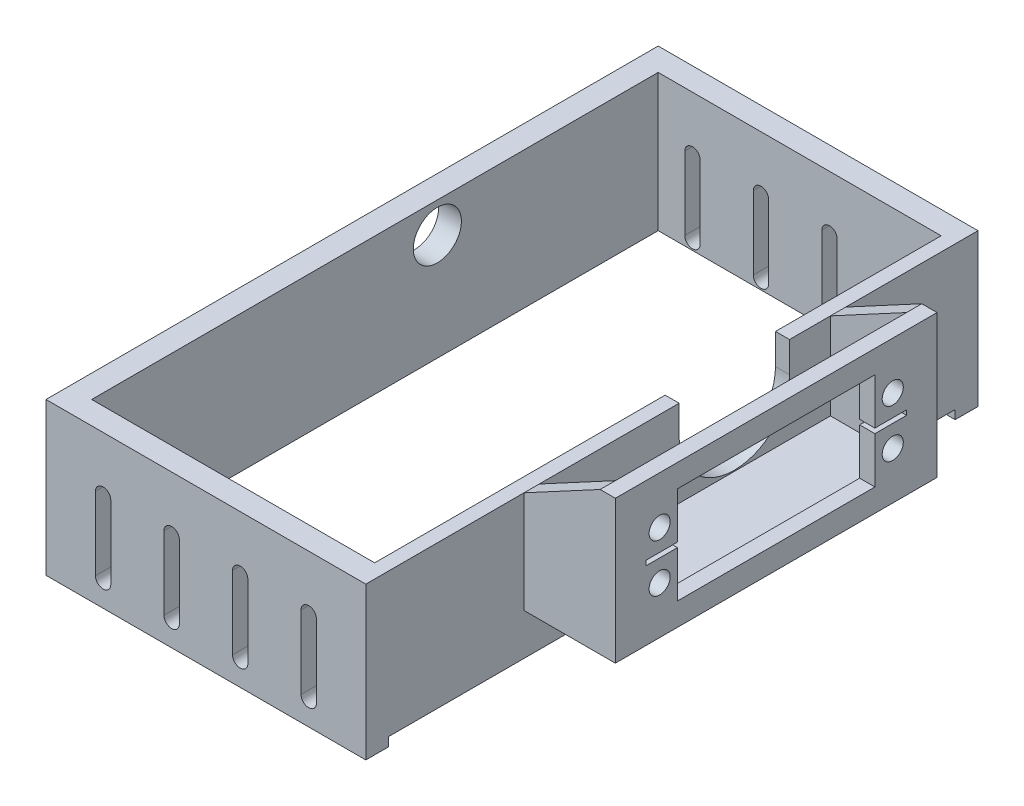
from build123d import *

# Parameters (mm, degrees)
SKETCH4_W                = 66.675
SKETCH4_H                = 127.62500002
SKETCH4_W_2              = 57.15
SKETCH4_H_2              = 118.10000002
BOSS_EXTRUDE1_DEPTH      = 19.05
BOSS_EXTRUDE2_START      = 19.05
SKETCH5_W                = 66.675
SKETCH5_H                = 127.62500002
BOSS_EXTRUDE2_DEPTH      = 12.7
FILLET1_SIZE             = 3.175
SKETCH14_W               = 57.15
SKETCH14_H               = 118.10000002
CUT_EXTRUDE8_DEPTH       = 12.7
SKETCH26_W               = 1.8415
SKETCH26_H               = 118.10000002
CUT_EXTRUDE11_DEPTH      = 79.685999795
CUT_EXTRUDE12_REACH      = 99.599
SKETCH27_W               = 118.10000002
SKETCH27_H               = 1.8415
SKETCH30_R               = 5.0165
CUT_EXTRUDE13_DEPTH      = 98.59945329
CUT_EXTRUDE16_DEPTH      = 2.921
BOSS_EXTRUDE4_DEPTH      = 19.05
SKETCH34_W               = 67.061999988
SKETCH34_H               = 29.778999878
BOSS_EXTRUDE5_DEPTH      = 3.175
CUT_EXTRUDE17_START      = 19.05
SKETCH32_R               = 2.200000045
CUT_EXTRUDE17_DEPTH      = 3.175
BOSS_EXTRUDE6_DEPTH      = 3.175
BOSS_EXTRUDE8_START      = -63.887
BOSS_EXTRUDE8_DEPTH      = 3.175
CUT_EXTRUDE18_DEPTH      = 144.721378339
CUT_EXTRUDE18_DEPTH_BACK = 144.721378339


with BuildPart() as part:
    # Sketch4 → Boss-Extrude1 (new body)
    with BuildSketch(Plane(origin=(0, 0, 0), x_dir=(1, 0, 0), z_dir=(0, 1, 0))):
        Rectangle(SKETCH4_W, SKETCH4_H)
        Rectangle(SKETCH4_W_2, SKETCH4_H_2, mode=Mode.SUBTRACT)
    extrude(amount=BOSS_EXTRUDE1_DEPTH)

    # Sketch5 → Boss-Extrude2 (add)
    with BuildSketch(Plane(origin=(0, 0, 0), x_dir=(1, 0, 0), z_dir=(0, 1, 0)).offset(BOSS_EXTRUDE2_START)):
        Rectangle(SKETCH5_W, SKETCH5_H)
    extrude(amount=BOSS_EXTRUDE2_DEPTH)

    # Fillet1
    fillet1_edges = [part.edges().sort_by_distance(p)[0] for p in [
        (-28.575, 0, 0),
        (0, 0, 59.05000001),
        (28.575, 0, 0),
        (0, 0, -59.05000001),
    ]]
    chamfer(fillet1_edges, length=FILLET1_SIZE)

    # Sketch14 → Cut-Extrude8 (cut)
    with BuildSketch(Plane.XZ.offset(-19.05)):
        Rectangle(SKETCH14_W, SKETCH14_H)
    extrude(amount=-CUT_EXTRUDE8_DEPTH, mode=Mode.SUBTRACT)

    # Sketch26 → Cut-Extrude11 (cut, through all)
    with BuildSketch(Plane(origin=(0, 31.75, 0), x_dir=(1, 0, 0), z_dir=(0, 1, 0))):
        with Locations((29.49575, 0)):
            Rectangle(SKETCH26_W, SKETCH26_H)
    extrude(amount=-CUT_EXTRUDE11_DEPTH, mode=Mode.SUBTRACT)

    # Sketch27 → Cut-Extrude12 (cut, up to next)
    with BuildSketch(Plane(origin=(33.3375, 0, 0), x_dir=(0, 0, -1), z_dir=(1, 0, 0)), mode=Mode.PRIVATE) as cut_extrude12_sk1:
        with Locations((0, 0.92075)):
            Rectangle(SKETCH27_W, SKETCH27_H)
    cut_extrude12_tool1 = extrude(cut_extrude12_sk1.sketch, amount=-CUT_EXTRUDE12_REACH, mode=Mode.PRIVATE) & part.part
    add(cut_extrude12_tool1.solids().sort_by_distance((33.3375, 0.92075, 0))[0], mode=Mode.SUBTRACT)

    # Sketch30 → Cut-Extrude13 (cut, through all)
    with BuildSketch(Plane.ZY.offset(33.3375)):
        with Locations((-13.01250001, 25.4)):
            Circle(SKETCH30_R)
    extrude(amount=-CUT_EXTRUDE13_DEPTH, mode=Mode.SUBTRACT)

    # Sketch31 → Cut-Extrude16 (cut)
    with BuildSketch(Plane(origin=(33.3375, 0, 0), x_dir=(0, 0, -1), z_dir=(1, 0, 0))):
        with BuildLine():
            Line((1.512500023, 25.4), (1.512500023, 31.75))
            Line((1.512500023, 31.75), (24.512499997, 31.75))
            Line((24.512499997, 31.75), (24.512499997, 25.4))
            ThreePointArc((24.512499997, 25.4), (13.01250001, 13.900000013), (1.512500023, 25.4))
        make_face()
    extrude(amount=-CUT_EXTRUDE16_DEPTH, mode=Mode.SUBTRACT)

    # Sketch33 → Boss-Extrude4 (add)
    with BuildSketch(Plane(origin=(33.3375, 0, 0), x_dir=(0, 0, -1), z_dir=(1, 0, 0))):
        Polygon((-27.666499912, 31.75), (-27.666499912, 13.685500061), (33.045500076, 13.685500061), (33.045500076, 31.75), (36.220500076, 31.75), (36.220500076, 10.510500061), (-30.841499912, 10.510500061), (-30.841499912, 31.75), align=None)
    extrude(amount=BOSS_EXTRUDE4_DEPTH)

    # Sketch34 → Boss-Extrude5 (add)
    with BuildSketch(Plane(origin=(52.3875, 0, 0), x_dir=(0, 0, -1), z_dir=(1, 0, 0))):
        with Locations((2.689500082, 25.4)):
            Rectangle(SKETCH34_W, SKETCH34_H)
    extrude(amount=-BOSS_EXTRUDE5_DEPTH)

    # Sketch32 → Cut-Extrude17 (cut)
    with BuildSketch(Plane(origin=(33.3375, 0, 0), x_dir=(0, 0, -1), z_dir=(1, 0, 0)).offset(CUT_EXTRUDE17_START)):
        with Locations((26.989500123, 30.400000033)):
            Circle(SKETCH32_R)
        with Locations((26.989500123, 20.399999967)):
            Circle(SKETCH32_R)
        with Locations((-21.610499959, 30.400000033)):
            Circle(SKETCH32_R)
        with Locations((-21.610499959, 20.399999967)):
            Circle(SKETCH32_R)
        Polygon((23.266500076, 15.273000061), (23.266500076, 24.9), (29.870500076, 24.9), (29.870500076, 25.9), (23.266500076, 25.9), (23.266500076, 35.526999939), (-17.887499912, 35.526999939), (-17.887499912, 25.9), (-24.491499912, 25.9), (-24.491499912, 24.9), (-17.887499912, 24.9), (-17.887499912, 15.273000061), align=None)
    extrude(amount=-CUT_EXTRUDE17_DEPTH, mode=Mode.SUBTRACT)

    # Sketch35 → Boss-Extrude6 (add)
    with BuildSketch(Plane(origin=(0, 0, -36.220500076), x_dir=(-1, 0, 0), z_dir=(0, 0, -1))):
        Polygon((-49.2125, 40.289499939), (-33.3375, 31.75), (-49.2125, 31.75), align=None)
    extrude(amount=-BOSS_EXTRUDE6_DEPTH)

    # Sketch35<2> → Boss-Extrude8 (add)
    with BuildSketch(Plane(origin=(0, 0, -36.220500076), x_dir=(-1, 0, 0), z_dir=(0, 0, -1)).offset(BOSS_EXTRUDE8_START)):
        Polygon((-49.2125, 40.289499939), (-33.3375, 31.75), (-49.2125, 31.75), align=None)
    extrude(amount=-BOSS_EXTRUDE8_DEPTH)

    # Sketch40 → Cut-Extrude18 (cut, two sides: drawn at the far end of the back side and taken through both)
    with BuildSketch(Plane(origin=(0, 0, -63.81250001), x_dir=(-1, 0, 0), z_dir=(0, 0, -1)).offset(-CUT_EXTRUDE18_DEPTH_BACK)):
        with BuildLine():
            Line((-5.543749898, 20.32), (-5.543749898, 5.08))
            ThreePointArc((-5.543749898, 5.08), (-7.14375, 3.479999898), (-8.743750102, 5.08))
            Line((-8.743750102, 5.08), (-8.743750102, 20.32))
            ThreePointArc((-8.743750102, 20.32), (-7.14375, 21.920000102), (-5.543749898, 20.32))
        make_face()
        with BuildLine():
            Line((8.743750102, 20.32), (8.743750102, 5.08))
            ThreePointArc((8.743750102, 5.08), (7.14375, 3.479999898), (5.543749898, 5.08))
            Line((5.543749898, 5.08), (5.543749898, 20.32))
            ThreePointArc((5.543749898, 20.32), (7.14375, 21.920000102), (8.743750102, 20.32))
        make_face()
        with BuildLine():
            Line((23.031250102, 20.32), (23.031250102, 5.08))
            ThreePointArc((23.031250102, 5.08), (21.43125, 3.479999898), (19.831249898, 5.08))
            Line((19.831249898, 5.08), (19.831249898, 20.32))
            ThreePointArc((19.831249898, 20.32), (21.43125, 21.920000102), (23.031250102, 20.32))
        make_face()
        with BuildLine():
            Line((-19.831249898, 20.32), (-19.831249898, 5.08))
            ThreePointArc((-19.831249898, 5.08), (-21.43125, 3.479999898), (-23.031250102, 5.08))
            Line((-23.031250102, 5.08), (-23.031250102, 20.32))
            ThreePointArc((-23.031250102, 20.32), (-21.43125, 21.920000102), (-19.831249898, 20.32))
        make_face()
    extrude(amount=CUT_EXTRUDE18_DEPTH + CUT_EXTRUDE18_DEPTH_BACK, mode=Mode.SUBTRACT)


solid = part.part
